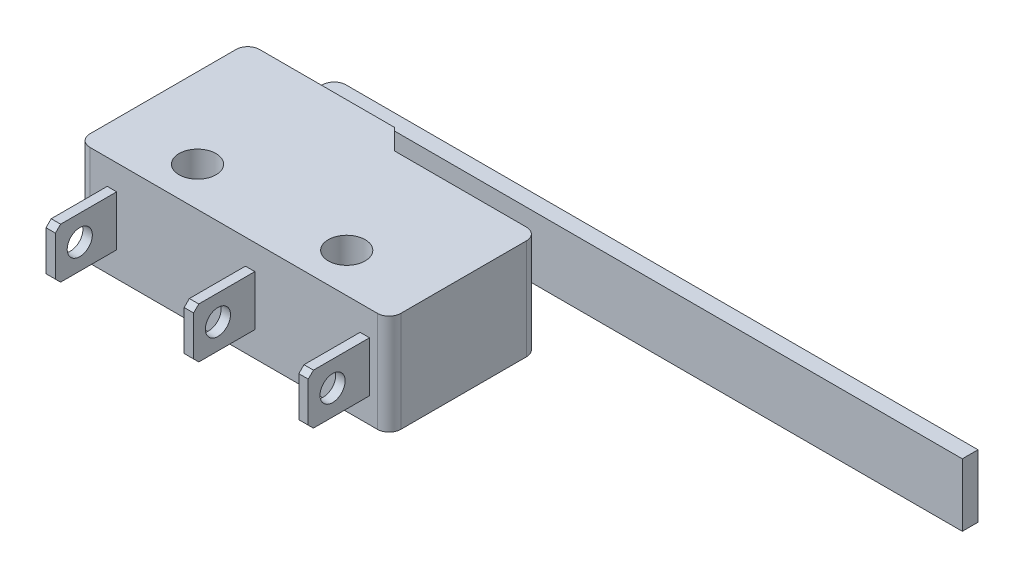
from build123d import *

# Parameters (mm, degrees)
SKETCH1_W           = 19.8
SKETCH1_H           = 9.5
BOSS_EXTRUDE1_DEPTH = 6.4
SKETCH2_W           = 10.65
SKETCH2_H           = 6.4
BOSS_EXTRUDE2_DEPTH = 1.3
CHAMFER3_SIZE       = 1.3
FILLET1_R           = 0.75
SKETCH3_W           = 1
SKETCH3_H           = 4
BOSS_EXTRUDE3_DEPTH = 2
SKETCH4_W           = 1
SKETCH4_H           = 4
BOSS_EXTRUDE4_DEPTH = 40
FILLET2_R           = 0.75
SKETCH5_R           = 1.175
CUT_EXTRUDE1_DEPTH  = 6.4
SKETCH6_W           = 0.6
SKETCH6_H           = 3.2
BOSS_EXTRUDE5_DEPTH = 3.9
SKETCH8_R           = 0.8
CUT_EXTRUDE2_DEPTH  = 16.7
CHAMFER4_SIZE       = 0.33


with BuildPart() as part:
    # Sketch1 → Boss-Extrude1 (new body)
    with BuildSketch(Plane(origin=(0, 0, 0), x_dir=(1, 0, 0), z_dir=(0, 1, 0))):
        Rectangle(SKETCH1_W, SKETCH1_H)
    extrude(amount=BOSS_EXTRUDE1_DEPTH)

    # Sketch2 → Boss-Extrude2 (add)
    with BuildSketch(Plane(origin=(0, 0, -4.75), x_dir=(-1, 0, 0), z_dir=(0, 0, -1))):
        with Locations((4.575, 3.2)):
            Rectangle(SKETCH2_W, SKETCH2_H)
    extrude(amount=BOSS_EXTRUDE2_DEPTH)

    # Chamfer3
    chamfer3_edges = [part.edges().sort_by_distance(p)[0] for p in [
        (0.75, 3.2, -6.05),
    ]]
    chamfer(chamfer3_edges, length=CHAMFER3_SIZE - 0.0001)  # a hair under: the kernel refuses the full size

    # Fillet1
    fillet1_edges = [part.edges().sort_by_distance(p)[0] for p in [
        (-9.9, 3.2, -6.05),
        (9.9, 3.2, 4.75),
        (-9.9, 3.2, 4.75),
        (9.9, 3.2, -4.75),
    ]]
    fillet(fillet1_edges, radius=FILLET1_R)

    # Sketch3 → Boss-Extrude3 (add)
    with BuildSketch(Plane(origin=(0, 0, -6.05), x_dir=(-1, 0, 0), z_dir=(0, 0, -1))):
        with Locations((5.9, 3.2)):
            Rectangle(SKETCH3_W, SKETCH3_H)
    extrude(amount=BOSS_EXTRUDE3_DEPTH)

    # Sketch4 → Boss-Extrude4 (add)
    with BuildSketch(Plane(origin=(-5.4, 0, 0), x_dir=(0, 0, -1), z_dir=(1, 0, 0))):
        with Locations((7.55, 3.2)):
            Rectangle(SKETCH4_W, SKETCH4_H)
    extrude(amount=BOSS_EXTRUDE4_DEPTH)

    # Fillet2
    fillet2_edges = [part.edges().sort_by_distance(p)[0] for p in [
        (-6.4, 3.2, -8.05),
    ]]
    fillet(fillet2_edges, radius=FILLET2_R)

    # Sketch5 → Cut-Extrude1 (cut)
    with BuildSketch(Plane(origin=(0, 6.4, 0), x_dir=(1, 0, 0), z_dir=(0, 1, 0))):
        with Locations(Location((-4.8, -2.25, 0), (0, 0, 270))):
            Circle(SKETCH5_R)
        with Locations(Location((4.7, -2.25, 0), (0, 0, 270))):
            Circle(SKETCH5_R)
    extrude(amount=-CUT_EXTRUDE1_DEPTH, mode=Mode.SUBTRACT)

    # Sketch6 → Boss-Extrude5 (add)
    with BuildSketch(Plane.XY.offset(4.75)):
        with Locations((-7.75, 3.2)):
            Rectangle(SKETCH6_W, SKETCH6_H)
        with Locations((1.05, 3.2)):
            Rectangle(SKETCH6_W, SKETCH6_H)
        with Locations((8.35, 3.2)):
            Rectangle(SKETCH6_W, SKETCH6_H)
    extrude(amount=BOSS_EXTRUDE5_DEPTH)

    # Sketch8 → Cut-Extrude2 (cut)
    with BuildSketch(Plane.ZY.offset(8.05)):
        with Locations((7.1, 3.2)):
            Circle(SKETCH8_R)
    extrude(amount=-CUT_EXTRUDE2_DEPTH, mode=Mode.SUBTRACT)

    # Chamfer4
    chamfer4_edges = [part.edges().sort_by_distance(p)[0] for p in [
        (-7.75, 1.6, 8.65),
        (-7.75, 4.8, 8.65),
        (1.05, 1.6, 8.65),
        (1.05, 4.8, 8.65),
        (8.35, 1.6, 8.65),
        (8.35, 4.8, 8.65),
    ]]
    chamfer(chamfer4_edges, length=CHAMFER4_SIZE)


solid = part.part
